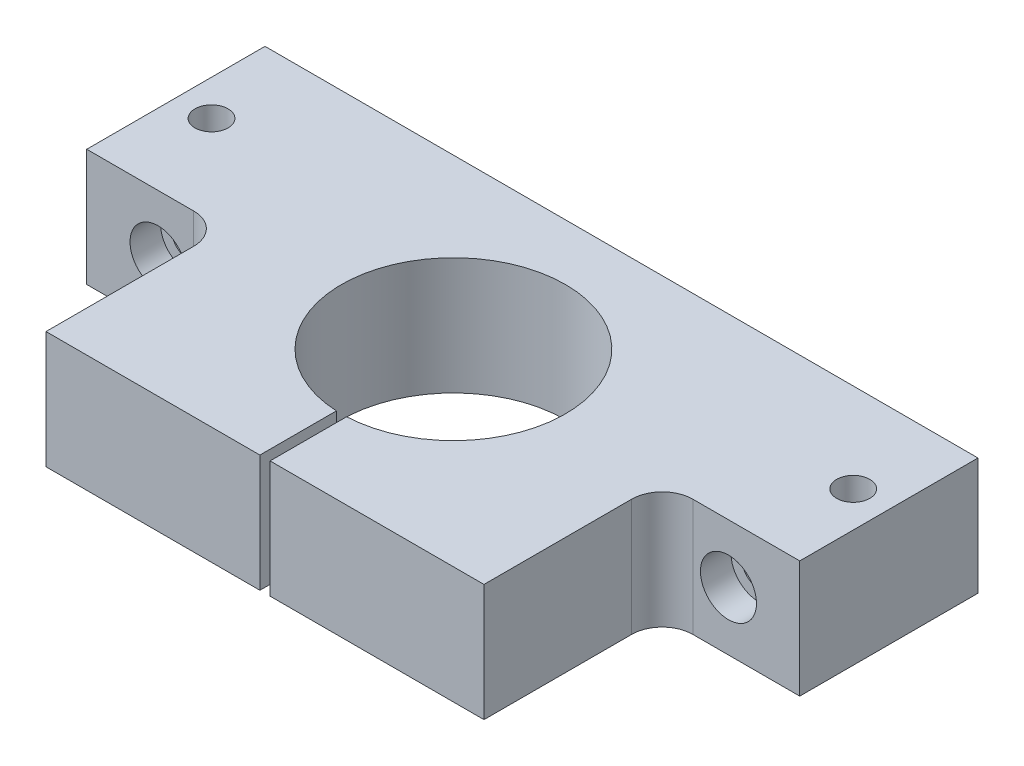
from build123d import *

# Parameters (mm, degrees)
DODANIE_WYCI_GNI_CIE1_DEPTH                        = 23
ZAOKR_GLENIE1_R                                    = 6
POG_BIENIE_START                                   = 27
POG_BIENIE_WALCOWE_POD_M6_WKR_T_DO_C_2_R           = 3.25
POG_BIENIE_WALCOWE_POD_M6_WKR_T_DO_CZ_CI_DEPTH     = 42
POG_BIENIE_WALCOWE_POD_M6_WKR_T_DO_C_3_O_R         = 5.5
POG_BIENIE_WALCOWE_POD_M6_WKR_T_DO_C_3_O_R_2       = 3.25
POG_BIENIE_WALCOWE_POD_M6_WKR_T_DO_C_3_DEPTH       = 7
OTW_R_GWINTOWANY_M6X1_01_D                         = 5
OTW_R_GWINTOWANY_M6X1_01_DEPTH                     = 17
OTW_R_GWINTOWANY_M6X1_01_TIP                       = 1.502151548
POG_BIENIE_WALCOWE_POD_M6_WKR_T_DO_C_4_D           = 6.6
POG_BIENIE_WALCOWE_POD_M6_WKR_T_DO_C_4_CBORE_D     = 11
POG_BIENIE_WALCOWE_POD_M6_WKR_T_DO_C_4_CBORE_DEPTH = 6
POG_BIENIE_WALCOWE_POD_M6_WKR_T_DO_C_5_D           = 6.5
POG_BIENIE_WALCOWE_POD_M6_WKR_T_DO_C_5_CBORE_D     = 11
POG_BIENIE_WALCOWE_POD_M6_WKR_T_DO_C_5_CBORE_DEPTH = 7


# Read off the part's stored shape, not the designer's step: Pogłębienie walcowe pod M6 Wkręt do części metalowych z łbem sześciokątnym1
with BuildPart() as part:
    # Szkic1 → Dodanie-wyciągnięcie1 (new body)
    with BuildSketch(Plane(origin=(0, 0, 0), x_dir=(1, 0, 0), z_dir=(0, 1, 0))):
        with BuildLine():
            Line((0, 0), (0, -35))
            Line((0, -35), (27, -35))
            Line((27, -35), (27, -70))
            Line((27, -70), (69, -70))
            Line((69, -70), (69, -54.977260976))
            ThreePointArc((69, -54.977260976), (48.005685491, -32.499870751), (70, -11))
            Line((70, -11), (70, 0))
            Line((70, 0), (0, 0))
        make_face()
        with BuildLine():
            Line((140, 0), (70, 0))
            Line((70, 0), (70, -11))
            ThreePointArc((70, -11), (91.994314509, -32.499870751), (71, -54.977260976))
            Line((71, -54.977260976), (71, -70))
            Line((71, -70), (113, -70))
            Line((113, -70), (113, -35))
            Line((113, -35), (140, -35))
            Line((140, -35), (140, 0))
        make_face()
    extrude(amount=DODANIE_WYCI_GNI_CIE1_DEPTH)

    # Zaokrąglenie1
    zaokr_glenie1_edges = [part.edges().sort_by_distance(p)[0] for p in [
        (27, 11.5, 35),
        (113, 11.5, 35),
    ]]
    fillet(zaokr_glenie1_edges, radius=ZAOKR_GLENIE1_R)

    # Pog_bienie walcowe pod M6 Wkr_t do c 2 → Pog_bienie walcowe pod M6 Wkr_t do cz_ci (cut)
    with BuildSketch(Plane.YZ.offset(POG_BIENIE_START)):
        with Locations((11.5, 63)):
            Circle(POG_BIENIE_WALCOWE_POD_M6_WKR_T_DO_C_2_R)
    extrude(amount=POG_BIENIE_WALCOWE_POD_M6_WKR_T_DO_CZ_CI_DEPTH, mode=Mode.SUBTRACT)

    # Pog_bienie walcowe pod M6 Wkr_t do c 3 o → Pog_bienie walcowe pod M6 Wkr_t do c 3 (cut)
    with BuildSketch(Plane.YZ.offset(POG_BIENIE_START)):
        with Locations((11.5, 63)):
            Circle(POG_BIENIE_WALCOWE_POD_M6_WKR_T_DO_C_3_O_R)
        with Locations((11.5, 63)):
            Circle(POG_BIENIE_WALCOWE_POD_M6_WKR_T_DO_C_3_O_R_2, mode=Mode.SUBTRACT)
    extrude(amount=POG_BIENIE_WALCOWE_POD_M6_WKR_T_DO_C_3_DEPTH, mode=Mode.SUBTRACT)

    # Otwór gwintowany M6x1.01
    with Locations(Plane.ZY.offset(-71)):
        with Locations((63, 11.5)):
            Hole(OTW_R_GWINTOWANY_M6X1_01_D / 2, depth=OTW_R_GWINTOWANY_M6X1_01_DEPTH)
            with Locations((0, 0, -(OTW_R_GWINTOWANY_M6X1_01_DEPTH + OTW_R_GWINTOWANY_M6X1_01_TIP / 2))):  # 118° drill point
                Cone(0, OTW_R_GWINTOWANY_M6X1_01_D / 2, OTW_R_GWINTOWANY_M6X1_01_TIP, mode=Mode.SUBTRACT)

    # Pog_bienie walcowe pod M6 Wkr_t do c 4 (through all)
    with Locations(Plane.XY.offset(35)):
        with Locations((14, 11.5), (126, 11.5)):
            CounterBoreHole(POG_BIENIE_WALCOWE_POD_M6_WKR_T_DO_C_4_D / 2, POG_BIENIE_WALCOWE_POD_M6_WKR_T_DO_C_4_CBORE_D / 2, POG_BIENIE_WALCOWE_POD_M6_WKR_T_DO_C_4_CBORE_DEPTH)

    # Pog_bienie walcowe pod M6 Wkr_t do c 5 (through all)
    with Locations(Plane(origin=(0, 0, 0), x_dir=(-1, 0, 0), z_dir=(0, -1, 0))):
        with Locations((-7, -17.5), (-133, -17.5)):
            CounterBoreHole(POG_BIENIE_WALCOWE_POD_M6_WKR_T_DO_C_5_D / 2, POG_BIENIE_WALCOWE_POD_M6_WKR_T_DO_C_5_CBORE_D / 2, POG_BIENIE_WALCOWE_POD_M6_WKR_T_DO_C_5_CBORE_DEPTH)


solid = part.part
